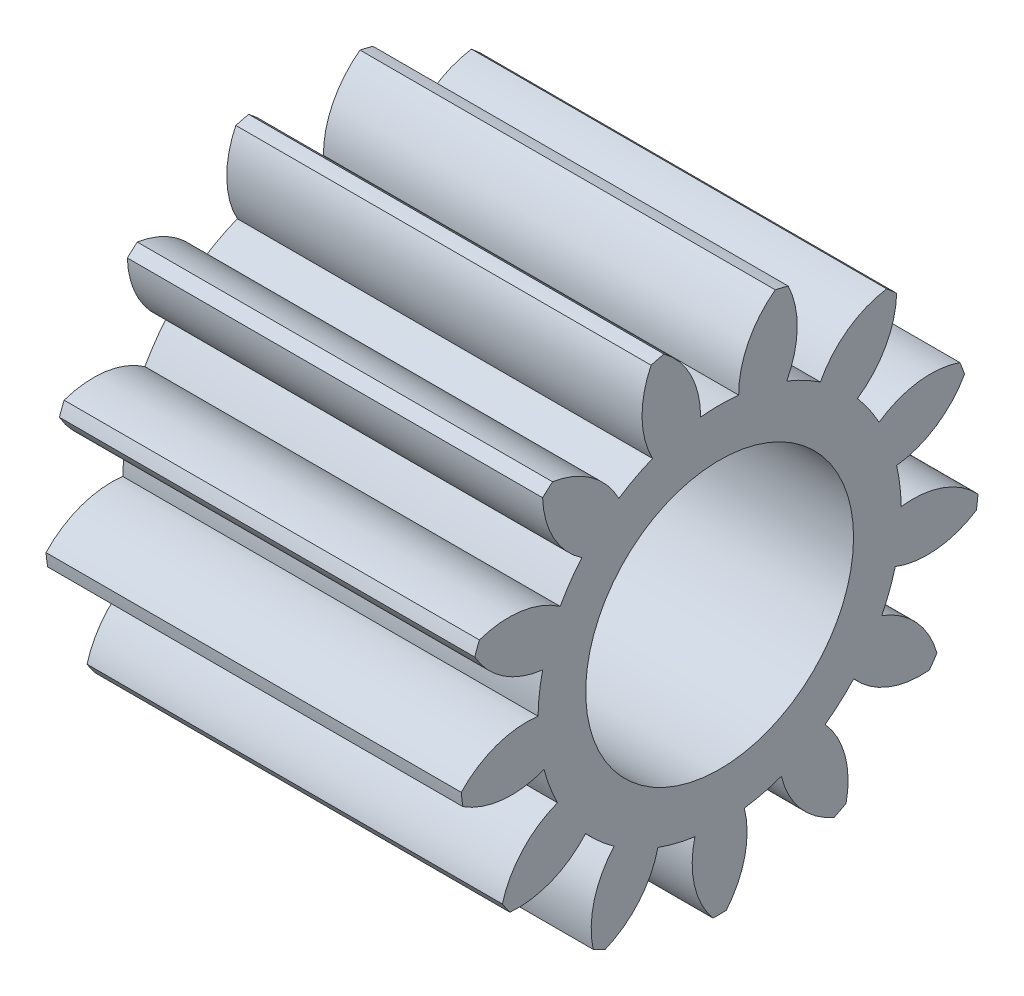
from build123d import *

# Parameters (mm, degrees)
BASPROSKE_W        = 6
BASPROSKE_H        = 3.75
TOOTHCUT_DEPTH     = 9.007808689
TEETHCUTS_COUNT    = 13
TEETHCUTS_ANGLE    = 332.307692308
BORSKE_R           = 0.4
BORE_DEPTH         = 50.0000508
SKETCH6_R          = 1.935
CUT_EXTRUDE1_DEPTH = 5


with BuildPart() as part:
    # BasProSke → Base-Revolve (revolve)
    with BuildSketch(Plane(origin=(0, 0, 0), x_dir=(1, 0, 0), z_dir=(0, 1, 0))):
        with Locations((3, 1.875)):
            Rectangle(BASPROSKE_W, BASPROSKE_H)
    revolve(axis=Axis((-10, 0, 0), (1, 0, 0)))

    # TooCutSke → ToothCut (cut, through all)
    with BuildSketch(Plane(origin=(0, 0, 0), x_dir=(0, 0, -1), z_dir=(1, 0, 0))):
        with BuildLine():
            ThreePointArc((0.275247387, 2.609523879), (0, 2.624), (-0.275247387, 2.609523879))
            ThreePointArc((-0.275247387, 2.609523879), (-0.421084752, 3.214694797), (-0.831556081, 3.682683756))
            ThreePointArc((-0.831556081, 3.682683756), (0, 3.7754), (0.831556081, 3.682683756))
            ThreePointArc((0.831556081, 3.682683756), (0.421084752, 3.214694797), (0.275247387, 2.609523879))
        make_face()
    toothcut = extrude(amount=TOOTHCUT_DEPTH, mode=Mode.SUBTRACT)

    # TeethCuts: ToothCut ×13 about axis
    teethcuts_axis = Axis((-10, 0, 0), (1, 0, 0))
    for i in range(1, TEETHCUTS_COUNT):
        add(toothcut.rotate(teethcuts_axis, i * TEETHCUTS_ANGLE / (TEETHCUTS_COUNT - 1)), mode=Mode.SUBTRACT)

    # BorSke → Bore (cut, symmetric)
    with BuildSketch(Plane(origin=(0, 0, 0), x_dir=(0, 0, -1), z_dir=(1, 0, 0))):
        Circle(BORSKE_R)
    extrude(amount=BORE_DEPTH, both=True, mode=Mode.SUBTRACT)

    # Sketch6 → Cut-Extrude1 (cut)
    with BuildSketch(Plane(origin=(6, 0, 0), x_dir=(0, 0, -1), z_dir=(1, 0, 0))):
        Circle(SKETCH6_R)
    extrude(amount=-CUT_EXTRUDE1_DEPTH, mode=Mode.SUBTRACT)


solid = part.part
